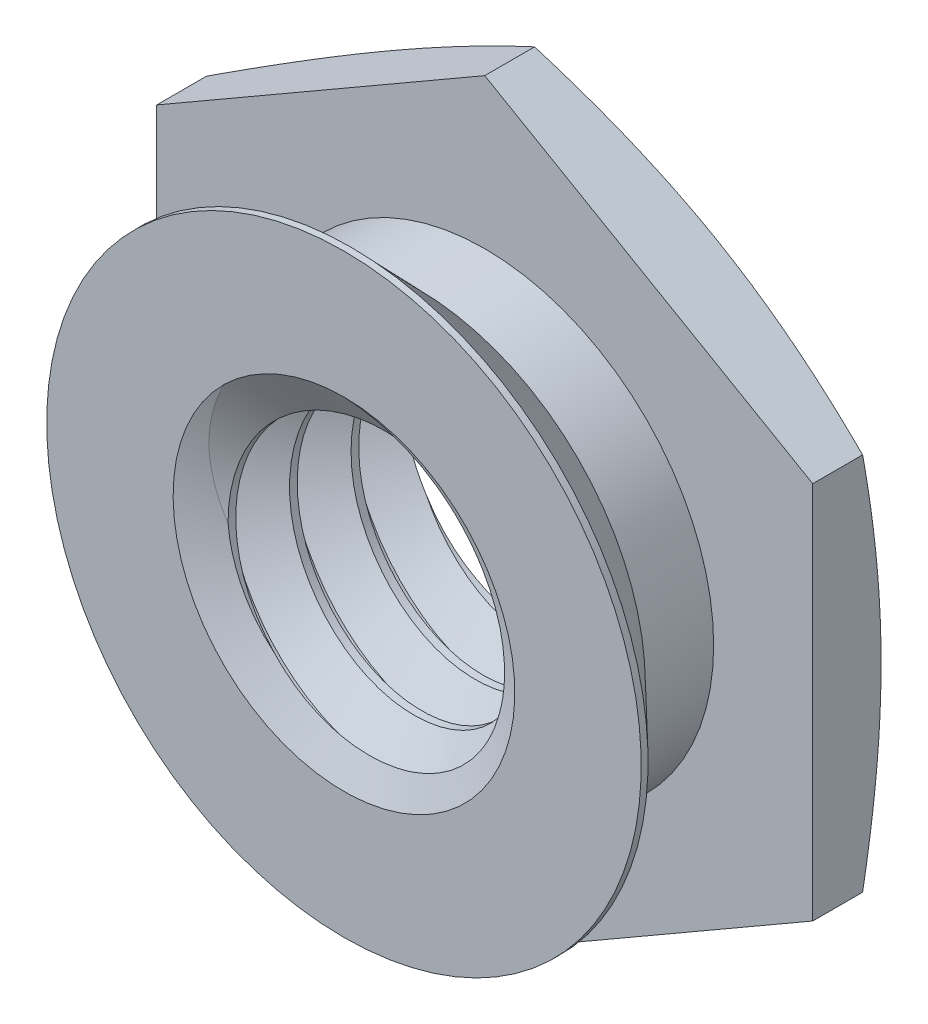
from build123d import *

# Parameters (mm, degrees)
BOSS_EXTRUDE1_DEPTH          = 0.5
SKETCH6_W                    = 1.53
SKETCH6_H                    = 1.25
SWEEP1_PITCH                 = 0.45
SKETCH12_R                   = 1.25
CUT_EXTRUDE4_OTHER_WAY_DEPTH = 10
CUT_EXTRUDE4_OTHER_WAY_TAPER = -45
SKETCH13_R                   = 1.25
CUT_EXTRUDE5_OTHER_WAY_DEPTH = 10
CUT_EXTRUDE5_OTHER_WAY_TAPER = -45


with BuildPart() as part:
    # Sketch1 → Revolve1 (revolve)
    with BuildSketch(Plane.ZY, mode=Mode.PRIVATE) as revolve1_sk:
        Polygon((0, 1.675), (0.5, 1.675), (0.98, 2.175), (1.03, 2.175), (1.03, 0), (0, 0), (-0.5, 0), (-0.5, 2.4), (0, 2.4), align=None)
    revolve(revolve1_sk.sketch.rotate(Axis((0, 0, 1.03), (0, 0, -1)), 180), axis=Axis((0, 0, 1.03), (0, 0, -1)))

    # Sketch3 → Boss-Extrude1 (add)
    with BuildSketch(Plane(origin=(0, 0, -0.5), x_dir=(-1, 0, 0), z_dir=(0, 0, -1))):
        Polygon((0, 2.771281292), (-2.4, 1.385640646), (-2.4, -1.385640646), (0, -2.771281292), (2.4, -1.385640646), (2.4, 1.385640646), align=None)
    extrude(amount=-BOSS_EXTRUDE1_DEPTH)

    # Sketch10 → Cut-Revolve4 (revolve, cut)
    with BuildSketch(Plane(origin=(0, 0, 0), x_dir=(0, 0, -1), z_dir=(1, 0, 0))):
        Polygon((0.364864661, 2.771281292), (0.5, 2.771281292), (0.5, 2.4), align=None)
    revolve(axis=Axis((0, 0, -0.5), (0, 0, 1)), mode=Mode.SUBTRACT)

    # Sketch6 → Cut-Revolve2 (revolve, cut)
    with BuildSketch(Plane(origin=(0, 0, 0), x_dir=(0, 0, -1), z_dir=(1, 0, 0)), mode=Mode.PRIVATE) as cut_revolve2_sk:
        with Locations((-0.265, 0.625)):
            Rectangle(SKETCH6_W, SKETCH6_H)
    revolve(cut_revolve2_sk.sketch.rotate(Axis((0, 0, -0.5), (0, 0, 1)), 90), axis=Axis((0, 0, -0.5), (0, 0, 1)), mode=Mode.SUBTRACT)

    # Sweep1: the profile of Sketch8 profile screwed along a right-hand helix of 4.4 turns, 6 arcs to a turn; built about Z, then put on its axis
    sweep1_z = Axis((0, 0, 0), (0, 0, 1))
    sweep1_corners = [(1.2503, 0, -0.393923205), (0.957716426, 0, -0.225), (0.957716426, 0, -0.16875), (1.2503, 0, 0.000173205)]
    with BuildLine(mode=Mode.PRIVATE) as sweep1_profile:
        Line(sweep1_corners[0], sweep1_corners[1])
        Line(sweep1_corners[1], sweep1_corners[2])
        Line(sweep1_corners[2], sweep1_corners[3])
        Line(sweep1_corners[3], sweep1_corners[0])
    sweep1_cap = Face(sweep1_profile.wire())
    sweep1_turn_angles = [0, 30, 60, 90, 120, 150, 180, 210, 240, 270, 300, 330, 360]
    sweep1_turn_weights = [1, 0.8660254037844387, 1, 0.8660254037844387, 1, 0.8660254037844387, 1, 0.8660254037844387, 1, 0.8660254037844387, 1, 0.8660254037844387, 1]
    sweep1_turn_rails = [Edge.make_bspline([Vector(p[0], p[1], 0).rotate(sweep1_z, sweep1_turn_angles[k]) / sweep1_turn_weights[k] + Vector(0, 0, p[2] + SWEEP1_PITCH * sweep1_turn_angles[k] / 360) for k in range(13)], [0, 0, 0, 1, 1, 2, 2, 3, 3, 4, 4, 5, 5, 6, 6, 6], 2, sweep1_turn_weights) for p in sweep1_corners]
    sweep1_turn_sides = [Face.make_surface_from_curves(sweep1_turn_rails[p[0]], sweep1_turn_rails[p[1]]) for p in [(0, 1), (1, 2), (2, 3), (3, 0)]]
    sweep1_last_angles = [1440, 1470, 1500, 1530, 1560, 1572, 1584]
    sweep1_last_weights = [1, 0.8660254037844387, 1, 0.8660254037844387, 1, 0.9781476007338019, 1]
    sweep1_last_rails = [Edge.make_bspline([Vector(p[0], p[1], 0).rotate(sweep1_z, sweep1_last_angles[k]) / sweep1_last_weights[k] + Vector(0, 0, p[2] + SWEEP1_PITCH * sweep1_last_angles[k] / 360) for k in range(7)], [0, 0, 0, 1, 1, 2, 2, 3, 3, 3], 2, sweep1_last_weights) for p in sweep1_corners]
    sweep1_last_sides = [Face.make_surface_from_curves(sweep1_last_rails[p[0]], sweep1_last_rails[p[1]]) for p in [(0, 1), (1, 2), (2, 3), (3, 0)]]
    sweep1 = Plane(origin=(0, 0, 1.03), x_dir=(0, 1, 0), z_dir=(0, 0, -1)) * Solid(Shell([*[p.moved(Location((0, 0, SWEEP1_PITCH * i))) for i in range(4) for p in sweep1_turn_sides], *sweep1_last_sides, sweep1_cap, sweep1_cap.rotate(sweep1_z, 1584).moved(Location((0, 0, SWEEP1_PITCH * 1584 / 360)))]))
    add(sweep1)

    # Cut-Extrude4 cone 1 section (through the dimple's axis) → Cut-Extrude4 (revolve, cut)
    with BuildSketch(Plane(origin=(0, 0, 1.03), x_dir=(0, -1, 0), z_dir=(1, 0, 0))):
        Polygon((0, 0), (1.25, 0), (0, 0.454962793), align=None)
    revolve(axis=Axis((0, 0, 1.03), (0, 0, -1)), mode=Mode.SUBTRACT)

    # Sketch12 → Cut-Extrude4 other way (cut)
    with BuildSketch(Plane.XY.offset(1.03)):
        Circle(SKETCH12_R)
    extrude(amount=CUT_EXTRUDE4_OTHER_WAY_DEPTH, taper=CUT_EXTRUDE4_OTHER_WAY_TAPER, mode=Mode.SUBTRACT)

    # Cut-Extrude5 cone 1 section (through the dimple's axis) → Cut-Extrude5 (revolve, cut)
    with BuildSketch(Plane(origin=(0, 0, -0.5), x_dir=(0, 1, 0), z_dir=(1, 0, 0))):
        Polygon((0, 0), (1.25, 0), (0, 0.454962793), align=None)
    revolve(axis=Axis((0, 0, -0.5), (0, 0, 1)), mode=Mode.SUBTRACT)

    # Sketch13 → Cut-Extrude5 other way (cut)
    with BuildSketch(Plane(origin=(0, 0, -0.5), x_dir=(-1, 0, 0), z_dir=(0, 0, -1))):
        Circle(SKETCH13_R)
    extrude(amount=CUT_EXTRUDE5_OTHER_WAY_DEPTH, taper=CUT_EXTRUDE5_OTHER_WAY_TAPER, mode=Mode.SUBTRACT)


solid = part.part
